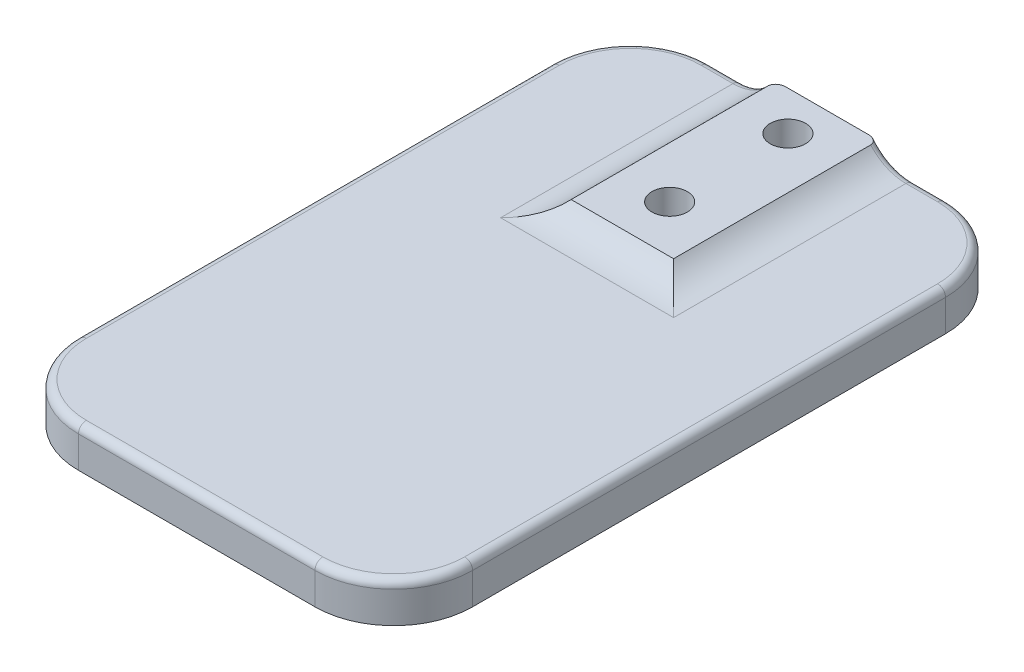
from build123d import *

# Parameters (mm, degrees)
SKETCH1_W           = 50
SKETCH1_H           = 80
BOSS_EXTRUDE1_DEPTH = 5
SKETCH2_W           = 13
SKETCH2_H           = 26
BOSS_EXTRUDE2_DEPTH = 2
SKETCH3_R           = 2.25
CUT_EXTRUDE1_DEPTH  = 48.68647607
FILLET1_R           = 10
FILLET2_R           = 6
FILLET3_R           = 1
CHAMFER1_SIZE       = 2.4


with BuildPart() as part:
    # Sketch1 → Boss-Extrude1 (new body)
    with BuildSketch(Plane(origin=(0, 0, 0), x_dir=(1, 0, 0), z_dir=(0, 1, 0))):
        Rectangle(SKETCH1_W, SKETCH1_H)
    extrude(amount=BOSS_EXTRUDE1_DEPTH)

    # Sketch2 → Boss-Extrude2 (add)
    with BuildSketch(Plane(origin=(0, 5, 0), x_dir=(1, 0, 0), z_dir=(0, 1, 0))):
        with Locations((0, 27)):
            Rectangle(SKETCH2_W, SKETCH2_H)
    extrude(amount=BOSS_EXTRUDE2_DEPTH)

    # Sketch3 → Cut-Extrude1 (cut, through all)
    with BuildSketch(Plane(origin=(0, 7, 0), x_dir=(1, 0, 0), z_dir=(0, 1, 0))):
        with Locations(Location((0, 35, 0), (0, 0, 270))):
            Circle(SKETCH3_R)
        with Locations(Location((0, 20, 0), (0, 0, 270))):
            Circle(SKETCH3_R)
    extrude(amount=-CUT_EXTRUDE1_DEPTH, mode=Mode.SUBTRACT)

    # Fillet1
    fillet1_edges = [part.edges().sort_by_distance(p)[0] for p in [
        (25, 2.5, 40),
        (-25, 2.5, 40),
        (-25, 2.5, -40),
        (25, 2.5, -40),
    ]]
    fillet(fillet1_edges, radius=FILLET1_R)

    # Fillet2
    # the kernel refuses this fillet: 6 mm, written as the material it adds along each edge
    with BuildSketch(Plane(origin=(6.5, 5, -14), x_dir=(1, 0, 0), z_dir=(0, 0, -1)), Plane(origin=(-6.5, 5, -40), x_dir=(-1, 0, 0), z_dir=(0, 0, 1))) as fillet2_piece_1:
        with BuildLine():
            CenterArc((4.472135955, -6), FILLET2_R, 90, 48.189685104)
            Line((0, -2), (-0.089442719, -1.92))
            ThreePointArc((-0.089442719, -1.92), (-0.12, -1), (-0.12, 0))
            Line((-0.12, 0), (0, 0.12))
            Line((0, 0.12), (4.472135955, 0.12))
            Line((4.472135955, 0.12), (4.472135955, 0))
        make_face()
    extrude(amount=26)
    with BuildSketch(Plane(origin=(-6.5, 5, -14), x_dir=(0, 0, 1), z_dir=(1, 0, 0))) as fillet2_piece_2:
        with BuildLine():
            CenterArc((4.472135955, -6), FILLET2_R, 90, 48.189685104)
            Line((0, -2), (-0.089442719, -1.92))
            ThreePointArc((-0.089442719, -1.92), (-0.12, -1), (-0.12, 0))
            Line((-0.12, 0), (0, 0.12))
            Line((0, 0.12), (4.472135955, 0.12))
            Line((4.472135955, 0.12), (4.472135955, 0))
        make_face()
    extrude(amount=13)
    with BuildSketch(Plane(origin=(-6.5, 5, -14), x_dir=(0, 0, 1), z_dir=(1, 0, 0))) as fillet2_piece_3a_section:
        with BuildLine():
            CenterArc((4.472135955, -6), FILLET2_R, 90, 48.189685104)
            Line((0, -2), (-0.089442719, -1.92))
            ThreePointArc((-0.089442719, -1.92), (-0.12, -1), (-0.12, 0))
            Line((-0.12, 0), (0, 0.12))
            Line((0, 0.12), (4.472135955, 0.12))
            Line((4.472135955, 0.12), (4.472135955, 0))
        make_face()
    fillet2_piece_3a = extrude(amount=24.180339887, mode=Mode.PRIVATE)
    fillet2_piece_3a = split(fillet2_piece_3a, bisect_by=Plane(origin=(6.5, 5.502082099, -12.82079949), z_dir=(1, 0, 0)), keep=Keep.TOP, mode=Mode.PRIVATE)
    with BuildSketch(Plane(origin=(6.5, 5, -2.819660113), x_dir=(1, 0, 0), z_dir=(0, 0, -1))) as fillet2_piece_3b_section:
        with BuildLine():
            CenterArc((4.472135955, -6), FILLET2_R, 90, 48.189685104)
            Line((0, -2), (-0.089442719, -1.92))
            ThreePointArc((-0.089442719, -1.92), (-0.12, -1), (-0.12, 0))
            Line((-0.12, 0), (0, 0.12))
            Line((0, 0.12), (4.472135955, 0.12))
            Line((4.472135955, 0.12), (4.472135955, 0))
        make_face()
    fillet2_piece_3b = extrude(amount=37.180339887, mode=Mode.PRIVATE)
    fillet2_piece_3b = split(fillet2_piece_3b, bisect_by=Plane(origin=(7.67920051, 5.502082099, -14), z_dir=(0, 0, 1)), keep=Keep.TOP, mode=Mode.PRIVATE)
    fillet2_piece_3 = fillet2_piece_3a & fillet2_piece_3b
    add(fillet2_piece_3)
    with BuildSketch(Plane(origin=(-6.5, 5, -40), x_dir=(-1, 0, 0), z_dir=(0, 0, 1))) as fillet2_piece_4a_section:
        with BuildLine():
            CenterArc((4.472135955, -6), FILLET2_R, 90, 48.189685104)
            Line((0, -2), (-0.089442719, -1.92))
            ThreePointArc((-0.089442719, -1.92), (-0.12, -1), (-0.12, 0))
            Line((-0.12, 0), (0, 0.12))
            Line((0, 0.12), (4.472135955, 0.12))
            Line((4.472135955, 0.12), (4.472135955, 0))
        make_face()
    fillet2_piece_4a = extrude(amount=37.180339887, mode=Mode.PRIVATE)
    fillet2_piece_4a = split(fillet2_piece_4a, bisect_by=Plane(origin=(-7.67920051, 5.502082099, -14), z_dir=(0, 0, 1)), keep=Keep.TOP, mode=Mode.PRIVATE)
    with BuildSketch(Plane(origin=(-17.680339887, 5, -14), x_dir=(0, 0, 1), z_dir=(1, 0, 0))) as fillet2_piece_4b_section:
        with BuildLine():
            CenterArc((4.472135955, -6), FILLET2_R, 90, 48.189685104)
            Line((0, -2), (-0.089442719, -1.92))
            ThreePointArc((-0.089442719, -1.92), (-0.12, -1), (-0.12, 0))
            Line((-0.12, 0), (0, 0.12))
            Line((0, 0.12), (4.472135955, 0.12))
            Line((4.472135955, 0.12), (4.472135955, 0))
        make_face()
    fillet2_piece_4b = extrude(amount=24.180339887, mode=Mode.PRIVATE)
    fillet2_piece_4b = split(fillet2_piece_4b, bisect_by=Plane(origin=(-6.5, 5.502082099, -12.82079949), z_dir=(-1, 0, 0)), keep=Keep.TOP, mode=Mode.PRIVATE)
    fillet2_piece_4 = fillet2_piece_4a & fillet2_piece_4b
    add(fillet2_piece_4)

    # Fillet3
    fillet3_edges = [part.edges().sort_by_distance(p)[0] for p in [
        (12.986067978, 5, -40),
        (25, 5, 0),
        (-25, 5, 0),
        (0, 5, 40),
        (-22.071067812, 5, -37.071067812),
        (-22.071067812, 5, 37.071067812),
        (22.071067812, 5, 37.071067812),
        (22.071067812, 5, -37.071067812),
        (-12.986067977, 5, -40),
        (8.522646212, 5.522774425, -40),
        (-8.522646212, 5.522774425, -40),
    ]]
    fillet(fillet3_edges, radius=FILLET3_R)

    # Chamfer1
    chamfer1_edges = [part.edges().sort_by_distance(p)[0] for p in [
        (0, 0, -37.25),
        (0, 0, -22.25),
    ]]
    chamfer(chamfer1_edges, length=CHAMFER1_SIZE)


solid = part.part
